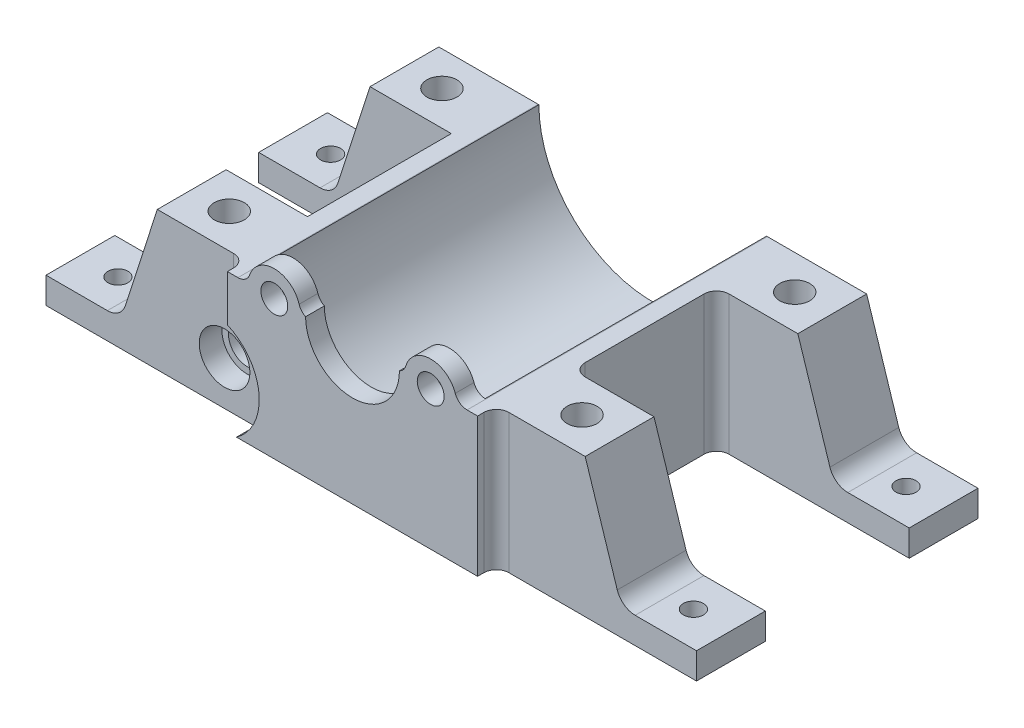
from build123d import *

# Parameters (mm, degrees)
BOSS_EXTRUDE1_DEPTH        = 22.5
SKETCH2_W                  = 30.8
SKETCH2_H                  = 23
CUT_EXTRUDE1_DEPTH         = 65
SKETCH3_R                  = 1.6
CUT_EXTRUDE2_DEPTH         = 65
SKETCH7_R                  = 2.15
MOTOR_MOUNTING_DEPTH       = 3
SKETCH4_R                  = 4.05
BEARING_HOLE_DEPTH         = 3.625
AXLE_THRU_HOLES_DEPTH      = 71.062333854
AXLE_THRU_HOLES_DEPTH_BACK = 71.062333854
SKETCH5_R                  = 3
FILLET3_R                  = 2
TOP_MOUNT_HOLES_DEPTH      = 63.024914385
TOP_MOUNT_HOLES_DEPTH_BACK = 7
SKETCH6_R                  = 2.4
FILLET4_R                  = 3
FILLET5_START              = 22.5
FILLET5_DEPTH              = 3
FILLET5_START_2            = -13.087721306
FILLET5_2_DEPTH            = 13.087721306
FILLET5_START_3            = -22.2
FILLET5_3_DEPTH            = 9.436583025
FILLET5_4_OUTLINE_R        = 4.05
FILLET5_4_DEPTH            = 2.71686
FILLET5_5_DEPTH            = 3
FILLET5_START_4            = -22.5
FILLET5_6_DEPTH            = 45
CUT_EXTRUDE3_REACH         = 76.168
SKETCH8_R                  = 8.55


with BuildPart() as part:
    # Sketch1 → Boss-Extrude1 (new, symmetric)
    with BuildSketch(Plane.XY):
        with BuildLine():
            Line((-18.2, 0), (-34.2, 0))
            Line((-34.2, 0), (-40, -18))
            Line((-40, -18), (-52, -18))
            Line((-52, -18), (-52, -22.2))
            Line((-52, -22.2), (0, -22.2))
            Line((0, -22.2), (52, -22.2))
            Line((52, -22.2), (52, -18))
            Line((52, -18), (40, -18))
            Line((40, -18), (34.2, 0))
            Line((34.2, 0), (18.2, 0))
            ThreePointArc((18.2, 0), (0, -18.2), (-18.2, 0))
        make_face()
    extrude(amount=BOSS_EXTRUDE1_DEPTH, both=True)

    # Sketch2 → Cut-Extrude1 (cut)
    with BuildSketch(Plane(origin=(0, 0, 0), x_dir=(1, 0, 0), z_dir=(0, 1, 0))):
        with Locations((-36.6, 0)):
            Rectangle(SKETCH2_W, SKETCH2_H)
        with Locations((36.6, 0)):
            Rectangle(SKETCH2_W, SKETCH2_H)
    extrude(amount=-CUT_EXTRUDE1_DEPTH, mode=Mode.SUBTRACT)

    # Sketch3 → Cut-Extrude2 (cut)
    with BuildSketch(Plane(origin=(0, -18, 0), x_dir=(1, 0, 0), z_dir=(0, 1, 0))):
        with Locations(Location((-46, 17, 0), (0, 0, 270))):
            Circle(SKETCH3_R)
        with Locations(Location((46, 17, 0), (0, 0, 270))):
            Circle(SKETCH3_R)
        with Locations(Location((46, -17, 0), (0, 0, 180))):
            Circle(SKETCH3_R)
        with Locations(Location((-46, -17, 0), (0, 0, 180))):
            Circle(SKETCH3_R)
    extrude(amount=-CUT_EXTRUDE2_DEPTH, mode=Mode.SUBTRACT)

    # Sketch7 → Motor-Mounting (add)
    with BuildSketch(Plane.XY.offset(22.5)):
        with BuildLine():
            Line((-7.5, 0), (-8.35, 0))
            ThreePointArc((-8.35, 0), (-12.5, 4.15), (-16.65, 0))
            Line((-16.65, 0), (-18.2, 0))
            Line((-18.2, 0), (-20, 0))
            Line((-20, 0), (-20, -22.2))
            Line((-20, -22.2), (0, -22.2))
            Line((0, -22.2), (20, -22.2))
            Line((20, -22.2), (20, 0))
            Line((20, 0), (18.2, 0))
            Line((18.2, 0), (16.65, 0))
            ThreePointArc((16.65, 0), (12.5, 4.15), (8.35, 0))
            Line((8.35, 0), (7.5, 0))
            ThreePointArc((7.5, 0), (0, -7.5), (-7.5, 0))
        make_face()
        with Locations((-12.5, 0)):
            Circle(SKETCH7_R, mode=Mode.SUBTRACT)
        with Locations(Location((12.5, 0, 0), (0, 0, 180))):
            Circle(SKETCH7_R, mode=Mode.SUBTRACT)
    extrude(amount=MOTOR_MOUNTING_DEPTH)

    # Sketch4 → Bearing-Hole (cut, symmetric)
    with BuildSketch(Plane.XY.offset(22.5)):
        with Locations((-23.455543055, -15.2)):
            Circle(SKETCH4_R)
    bearing_hole = extrude(amount=BEARING_HOLE_DEPTH, both=True, mode=Mode.SUBTRACT)

    # Mirror1: Bearing-Hole across plane
    add(bearing_hole.mirror(Plane.XY), mode=Mode.SUBTRACT)

    # Sketch5 → Axle-Thru-Holes (cut, two sides: drawn at the far end of the back side and taken through both)
    with BuildSketch(Plane.XY.offset(18.875).offset(-AXLE_THRU_HOLES_DEPTH_BACK)):
        with Locations((-23.455543055, -15.2)):
            Circle(SKETCH5_R)
    extrude(amount=AXLE_THRU_HOLES_DEPTH + AXLE_THRU_HOLES_DEPTH_BACK, mode=Mode.SUBTRACT)

    # Fillet3
    fillet3_edges = [part.edges().sort_by_distance(p)[0] for p in [
        (21.2, -11.1, -11.5),
        (21.2, -11.1, 11.5),
        (-21.2, -19.689005249, 11.5),
        (-21.2, -19.689005249, -11.5),
    ]]
    fillet(fillet3_edges, radius=FILLET3_R)

    # Sketch6 → Top-Mount-Holes (cut, two sides: drawn at the far end of the back side and taken through both)
    with BuildSketch(Plane(origin=(0, 0, 0), x_dir=(1, 0, 0), z_dir=(0, 1, 0)).offset(-TOP_MOUNT_HOLES_DEPTH_BACK)):
        with Locations((-28.2, 17)):
            Circle(SKETCH6_R)
        with Locations((28.2, 17)):
            Circle(SKETCH6_R)
        with Locations(Location((28.2, -17, 0), (0, 0, 90))):
            Circle(SKETCH6_R)
        with Locations((-28.2, -17)):
            Circle(SKETCH6_R)
    extrude(amount=TOP_MOUNT_HOLES_DEPTH + TOP_MOUNT_HOLES_DEPTH_BACK, mode=Mode.SUBTRACT)

    # Fillet4
    fillet4_edges = [part.edges().sort_by_distance(p)[0] for p in [
        (40, -18, 17),
        (-40, -18, 17),
        (40, -18, -17),
        (-40, -18, -17),
    ]]
    fillet(fillet4_edges, radius=FILLET4_R)

    # Fillet5: read off the stored shape, not the designer's step
    # Fillet5 outline → Fillet5 (add)
    with BuildSketch(Plane.XY.offset(FILLET5_START)):
        with BuildLine():
            ThreePointArc((-7.5, 0), (-8.14090356, 0.498741958), (-8.530676829, 1.211186842))
            ThreePointArc((-8.530676829, 1.211186842), (-8.395417734, 0.612294391), (-8.35, 0))
            Line((-8.35, 0), (-7.5, 0))
        make_face()
        with BuildLine():
            ThreePointArc((8.530676829, 1.211186842), (8.14090356, 0.498741958), (7.5, 0))
            Line((7.5, 0), (8.35, 0))
            ThreePointArc((8.35, 0), (8.395417734, 0.612294391), (8.530676829, 1.211186842))
        make_face()
    extrude(amount=FILLET5_DEPTH)

    # Fillet5 2 outline → Fillet5 2 (add)
    with BuildSketch(Plane(origin=(0, 0, 0), x_dir=(1, 0, 0), z_dir=(0, 1, 0)).offset(FILLET5_START_2)):
        with BuildLine():
            ThreePointArc((-22, -22.5), (-20.585786438, -23.085786438), (-20, -24.5))
            Line((-20, -24.5), (-20, -22.5))
            Line((-20, -22.5), (-22, -22.5))
        make_face()
        with BuildLine():
            ThreePointArc((20, -24.5), (20.585786438, -23.085786438), (22, -22.5))
            Line((22, -22.5), (20, -22.5))
            Line((20, -22.5), (20, -24.5))
        make_face()
    extrude(amount=FILLET5_2_DEPTH)

    # Fillet5 3 outline → Fillet5 3 (add)
    with BuildSketch(Plane(origin=(0, 0, 0), x_dir=(1, 0, 0), z_dir=(0, 1, 0)).offset(FILLET5_START_3)):
        with BuildLine():
            ThreePointArc((20, -24.5), (20.585786438, -23.085786438), (22, -22.5))
            Line((22, -22.5), (20, -22.5))
            Line((20, -22.5), (20, -24.5))
        make_face()
    extrude(amount=FILLET5_3_DEPTH)

    # Fillet5 4 outline → Fillet5 4 (cut)
    with BuildSketch(Plane.XY.offset(FILLET5_START)):
        with Locations((-23.455543055, -15.2)):
            Circle(FILLET5_4_OUTLINE_R)
    extrude(amount=FILLET5_4_DEPTH, mode=Mode.SUBTRACT)

    # Fillet5 5 outline → Fillet5 5 (add)
    with BuildSketch(Plane.XY.offset(FILLET5_START)):
        with BuildLine():
            ThreePointArc((18.315711478, 0), (17.153991419, 0.371993088), (16.424423193, 1.349593496))
            ThreePointArc((16.424423193, 1.349593496), (16.593217332, 0.684157785), (16.65, 0))
            Line((16.65, 0), (18.315711478, 0))
        make_face()
        with BuildLine():
            Line((-18.315711478, 0), (-16.65, 0))
            ThreePointArc((-16.65, 0), (-16.593217332, 0.684157785), (-16.424423193, 1.349593496))
            ThreePointArc((-16.424423193, 1.349593496), (-17.153991419, 0.371993088), (-18.315711478, 0))
        make_face()
    extrude(amount=FILLET5_5_DEPTH)

    # Fillet5 6 outline → Fillet5 6 (add)
    with BuildSketch(Plane.XY.offset(FILLET5_START_4)):
        with BuildLine():
            Line((18.2, 0), (18.315711478, 0))
            ThreePointArc((18.315711478, 0), (18.257831342, 0.000837703), (18.199999692, 0.00335011))
            ThreePointArc((18.199999692, 0.00335011), (18.199999923, 0.001675055), (18.2, 0))
        make_face()
        with BuildLine():
            Line((-18.315711478, 0), (-18.2, 0))
            ThreePointArc((-18.2, 0), (-18.199999923, 0.001675055), (-18.199999692, 0.00335011))
            ThreePointArc((-18.199999692, 0.00335011), (-18.257831342, 0.000837703), (-18.315711478, 0))
        make_face()
    extrude(amount=FILLET5_6_DEPTH)

    # Cut-Extrude3: up to this face of the body (flat: up to its plane)
    cut_extrude3_end = Plane(part.part.faces().sort_by_distance((-32.525053026, -12.842804107, 22.5))[0])
    # Sketch8 → Cut-Extrude3 (cut, up to the picked face)
    with BuildSketch(Plane.XY.offset(25.5), mode=Mode.PRIVATE) as cut_extrude3_sk1:
        with Locations((-23.455543055, -15.2)):
            Circle(SKETCH8_R)
    cut_extrude3_tool1 = split(extrude(cut_extrude3_sk1.sketch, amount=-CUT_EXTRUDE3_REACH, mode=Mode.PRIVATE), bisect_by=cut_extrude3_end, keep=Keep.BOTH, mode=Mode.PRIVATE)
    add(cut_extrude3_tool1.solids().sort_by(Axis((-23.455543, -15.2, 25.5), (0, 0, -1)))[0], mode=Mode.SUBTRACT)


solid = part.part
